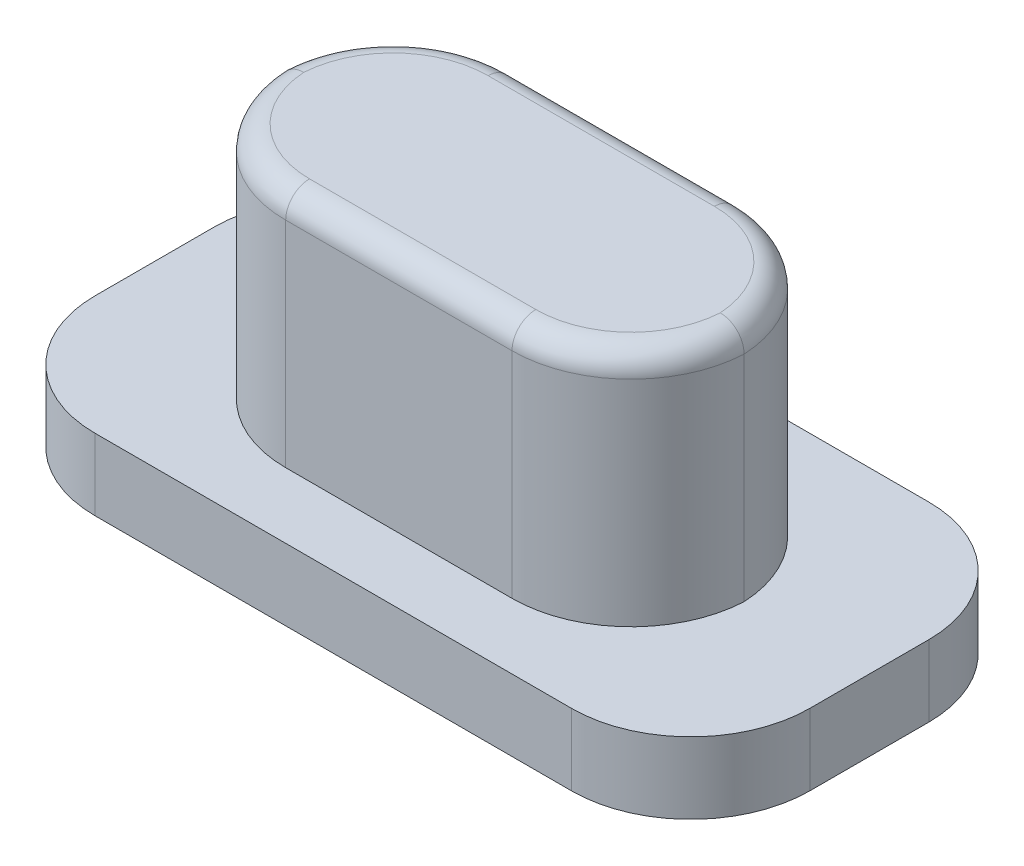
from build123d import *

# Parameters (mm, degrees)
SKETCH_1_W      = 6
SKETCH_1_H      = 3
EXTRUDE_1_DEPTH = 0.6
SKETCH_2_W      = 3.9
SKETCH_2_H      = 1.9
EXTRUDE_2_DEPTH = 2
FILLET_1_R      = 1
SKETCH_3_W      = 3
SKETCH_3_H      = 1.6
EXTRUDE_3_DEPTH = 0.2
FILLET_2_R      = 0.2


with BuildPart() as part:
    # 草图1 → 凸台-拉伸1 (new body)
    with BuildSketch(Plane(origin=(0, 0, 0), x_dir=(1, 0, 0), z_dir=(0, 1, 0))):
        with Locations((0.496893044, 0.260354793)):
            Rectangle(SKETCH_1_W, SKETCH_1_H)
    extrude(amount=EXTRUDE_1_DEPTH)

    # 草图2 → 凸台-拉伸2 (add)
    with BuildSketch(Plane(origin=(0, 0.6, 0), x_dir=(1, 0, 0), z_dir=(0, 1, 0))):
        with Locations((0.496893044, 0.260354793)):
            Rectangle(SKETCH_2_W, SKETCH_2_H)
    extrude(amount=EXTRUDE_2_DEPTH)

    # 圆角1
    # the kernel refuses this fillet: 1 mm, written as the material it takes off along each edge
    with BuildSketch(Plane(origin=(3.496893044, -2.5, -1.760354793), x_dir=(-1, 0, 0), z_dir=(0, 1, 0)), Plane(origin=(3.496893044, -2.5, 1.239645207), x_dir=(0, 0, -1), z_dir=(0, 1, 0))) as fillet_1_piece_1:
        with BuildLine():
            CenterArc((FILLET_1_R, FILLET_1_R), FILLET_1_R, 180, 90)
            Line((0, FILLET_1_R), (0, 0))
            Line((0, 0), (FILLET_1_R, 0))
        make_face()
    extrude(amount=5.6, mode=Mode.SUBTRACT)
    with BuildSketch(Plane(origin=(-2.503106956, -2.5, -1.760354793), x_dir=(1, 0, 0), z_dir=(0, 1, 0)), Plane(origin=(-2.503106956, -2.5, 1.239645207), x_dir=(0, 0, -1), z_dir=(0, 1, 0))) as fillet_1_piece_2:
        with BuildLine():
            CenterArc((FILLET_1_R, -FILLET_1_R), FILLET_1_R, 90, 90)
            Line((0, -FILLET_1_R), (0, 0))
            Line((0, 0), (FILLET_1_R, 0))
        make_face()
    extrude(amount=5.6, mode=Mode.SUBTRACT)
    with BuildSketch(Plane(origin=(2.446893044, 0.6, -1.210354793), x_dir=(-1, 0, 0), z_dir=(0, 1, 0)), Plane(origin=(-1.453106956, 0.6, 0.689645207), x_dir=(1, 0, 0), z_dir=(0, 1, 0)), Plane(origin=(2.446893044, 0.6, 0.689645207), x_dir=(0, 0, -1), z_dir=(0, 1, 0))) as fillet_1_piece_3:
        with BuildLine():
            CenterArc((FILLET_1_R, FILLET_1_R), FILLET_1_R, 180, 90)
            Line((0, FILLET_1_R), (0, 0))
            Line((0, 0), (FILLET_1_R, 0))
        make_face()
    extrude(amount=4.5, mode=Mode.SUBTRACT)
    with BuildSketch(Plane(origin=(-1.453106956, 0.6, -1.210354793), x_dir=(1, 0, 0), z_dir=(0, 1, 0))) as fillet_1_piece_4:
        with BuildLine():
            CenterArc((FILLET_1_R, -FILLET_1_R), FILLET_1_R, 90, 90)
            Line((0, -FILLET_1_R), (0, 0))
            Line((0, 0), (FILLET_1_R, 0))
        make_face()
    extrude(amount=4.5, mode=Mode.SUBTRACT)

    # 草图3 → 凸台-拉伸3 (add)
    with BuildSketch(Plane(origin=(0, 0, 0), x_dir=(-1, 0, 0), z_dir=(0, -1, 0))):
        with Locations((-0.496893044, 0.260354793)):
            Rectangle(SKETCH_3_W, SKETCH_3_H)
    extrude(amount=EXTRUDE_3_DEPTH)

    # 圆角2
    # the kernel refuses this fillet: 0.2 mm, written as the material it takes off along each edge
    with BuildSketch(Plane(origin=(-0.453106956, 2.6, -1.210354793), x_dir=(0, -1, 0), z_dir=(1, 0, 0)), Plane(origin=(1.446893044, 2.6, 0.689645207), x_dir=(0, -1, 0), z_dir=(-1, 0, 0))) as fillet_2_piece_1:
        with BuildLine():
            CenterArc((FILLET_2_R, -FILLET_2_R), FILLET_2_R, 90, 90)
            Line((0, -FILLET_2_R), (0, 0))
            Line((0, 0), (FILLET_2_R, 0))
        make_face()
    extrude(amount=1.9, mode=Mode.SUBTRACT)
    with BuildSketch(Plane(origin=(1.446893044, 2.6, -0.310354793), x_dir=(0.900374274099907, 0, -0.4351162678400631), z_dir=(-0.4351162678400631, 0, -0.900374274099907))) as fillet_2_piece_2:
        with BuildLine():
            CenterArc((1 - FILLET_2_R, FILLET_2_R), FILLET_2_R, 270, 90)
            Line((1 - FILLET_2_R, 0), (1, 0))
            Line((1, 0), (1, FILLET_2_R))
        make_face()
    revolve(axis=Axis((1.446893044, 2.6, -0.310354793), (0, -1, 0)), revolution_arc=115.792692411, mode=Mode.SUBTRACT)
    with BuildSketch(Plane(origin=(1.446893044, 2.6, -0.210354793), x_dir=(0, 0, -1), z_dir=(-1, 0, 0))) as fillet_2_piece_3:
        with BuildLine():
            CenterArc((1 - FILLET_2_R, FILLET_2_R), FILLET_2_R, 270, 90)
            Line((1 - FILLET_2_R, 0), (1, 0))
            Line((1, 0), (1, FILLET_2_R))
        make_face()
    revolve(axis=Axis((1.446893044, 2.6, -0.210354793), (0, -1, 0)), revolution_arc=115.792692411, mode=Mode.SUBTRACT)
    with BuildSketch(Plane(origin=(-0.453106956, 2.6, -0.310354793), x_dir=(0, 0, 1), z_dir=(1, 0, 0))) as fillet_2_piece_4:
        with BuildLine():
            CenterArc((1 - FILLET_2_R, FILLET_2_R), FILLET_2_R, 270, 90)
            Line((1 - FILLET_2_R, 0), (1, 0))
            Line((1, 0), (1, FILLET_2_R))
        make_face()
    revolve(axis=Axis((-0.453106956, 2.6, -0.310354793), (0, -1, 0)), revolution_arc=115.792692411, mode=Mode.SUBTRACT)
    with BuildSketch(Plane(origin=(-0.453106956, 2.6, -0.210354793), x_dir=(-0.9003742740999057, 0, 0.43511626784006596), z_dir=(0.43511626784006596, 0, 0.9003742740999057))) as fillet_2_piece_5:
        with BuildLine():
            CenterArc((1 - FILLET_2_R, FILLET_2_R), FILLET_2_R, 270, 90)
            Line((1 - FILLET_2_R, 0), (1, 0))
            Line((1, 0), (1, FILLET_2_R))
        make_face()
    revolve(axis=Axis((-0.453106956, 2.6, -0.210354793), (0, -1, 0)), revolution_arc=115.792692411, mode=Mode.SUBTRACT)


solid = part.part
